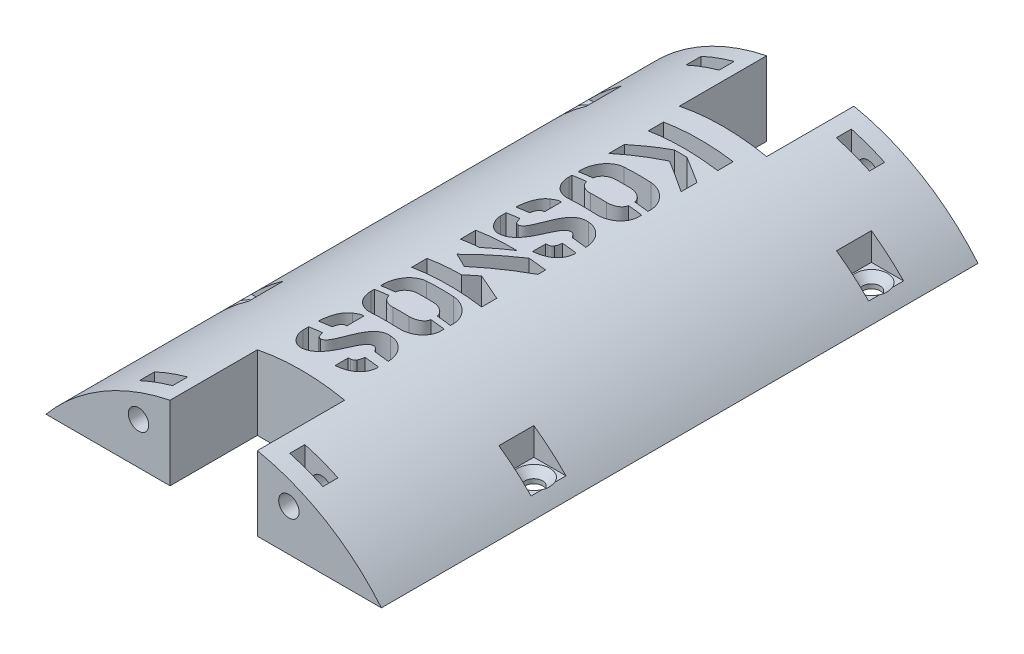
from build123d import *

# Parameters (mm, degrees)
BOSS_EXTRU_2_DEPTH       = 102.5
ESQUISSE7_R              = 1.75
ENL_V_MAT_EXTRU_4_DEPTH  = 12
ENL_V_START              = -5.6
ENL_V_MAT_EXTRU_5_DEPTH  = 2.6
ENL_V_START_2            = -12
ESQUISSE12_R             = 1.75
ENL_V_MAT_EXTRU_6_DEPTH  = 12
ENL_V_START_3            = -3
ENL_V_MAT_EXTRU_7_DEPTH  = 2.6
ESQUISSE21_W             = 15
ESQUISSE21_H             = 15
ENL_V_MAT_EXTRU_14_DEPTH = 108.325439668
ESQUISSE23_R             = 1.5
ENL_V_MAT_EXTRU_15_DEPTH = 108.325439668
ENL_V_START_4            = -2
ESQUISSE24_W             = 6
ESQUISSE24_H             = 6
ENL_V_MAT_EXTRU_16_DEPTH = 106.325439803
ENL_V_START_5            = 24
ENL_V_MAT_EXTRU_18_DEPTH = 13.5
CHANFREIN1_SIZE          = 1.25


# Read off the part's stored shape, not the designer's step: Enlèv. mat.-Extru.18
with BuildPart() as part:
    # Esquisse3 → Boss.-Extru.2 (new body)
    with BuildSketch(Plane.XY):
        with BuildLine():
            ThreePointArc((-28.814059068, 24), (0, 37.5), (28.814059068, 24))
            Line((28.814059068, 24), (18, 24))
            Line((18, 24), (-18, 24))
            Line((-18, 24), (-28.814059068, 24))
        make_face()
    extrude(amount=BOSS_EXTRU_2_DEPTH)

    # Esquisse7 → Enlèv. mat.-Extru.4 (cut)
    with BuildSketch(Plane.XY.offset(102.5)):
        with Locations((-12.915565842, 31.180934222)):
            Circle(ESQUISSE7_R)
        with Locations((12.915565842, 31.180934222)):
            Circle(ESQUISSE7_R)
    extrude(amount=-ENL_V_MAT_EXTRU_4_DEPTH, mode=Mode.SUBTRACT)

    # Esquisse11 → Enlèv. mat.-Extru.5 (cut)
    with BuildSketch(Plane.XY.offset(102.5).offset(ENL_V_START)):
        with BuildLine():
            Line((-15.765565842, 31.180934222), (-15.765565842, 34.024945756))
            ThreePointArc((-15.765565842, 34.024945756), (-12.95813326, 35.190009696), (-10.065565842, 36.123875543))
            Line((-10.065565842, 36.123875543), (-10.065565842, 29.426382489))
            Line((-10.065565842, 29.426382489), (-12.915565842, 27.780934222))
            Line((-12.915565842, 27.780934222), (-15.765565842, 29.426382489))
            Line((-15.765565842, 29.426382489), (-15.765565842, 31.180934222))
        make_face()
        with BuildLine():
            Line((10.065565842, 36.123875543), (10.065565842, 29.426382489))
            Line((10.065565842, 29.426382489), (12.915565842, 27.780934222))
            Line((12.915565842, 27.780934222), (15.765565842, 29.426382489))
            Line((15.765565842, 29.426382489), (15.765565842, 34.024945756))
            ThreePointArc((15.765565842, 34.024945756), (12.95813326, 35.190009696), (10.065565842, 36.123875543))
        make_face()
    extrude(amount=ENL_V_MAT_EXTRU_5_DEPTH, mode=Mode.SUBTRACT)

    # Esquisse12 → Enlèv. mat.-Extru.6 (cut)
    with BuildSketch(Plane(origin=(0, 0, 0), x_dir=(-1, 0, 0), z_dir=(0, 0, -1)).offset(ENL_V_START_2)):
        with Locations(Location((-12.915565842, 31.180934222, 0), (0, 0, 180))):
            Circle(ESQUISSE12_R)
        with Locations(Location((12.915565842, 31.180934222, 0), (0, 0, 180))):
            Circle(ESQUISSE12_R)
    extrude(amount=ENL_V_MAT_EXTRU_6_DEPTH, mode=Mode.SUBTRACT)

    # Esquisse14 → Enlèv. mat.-Extru.7 (cut)
    with BuildSketch(Plane(origin=(0, 0, 0), x_dir=(-1, 0, 0), z_dir=(0, 0, -1)).offset(ENL_V_START_3)):
        with BuildLine():
            Line((-15.765565842, 31.689067965), (-15.765565842, 34.024945756))
            ThreePointArc((-15.765565842, 34.024945756), (-12.95813326, 35.190009696), (-10.065565842, 36.123875543))
            Line((-10.065565842, 36.123875543), (-10.065565842, 29.426382489))
            Line((-10.065565842, 29.426382489), (-12.915565842, 27.780934222))
            Line((-12.915565842, 27.780934222), (-15.765565842, 29.426382489))
            Line((-15.765565842, 29.426382489), (-15.765565842, 31.689067965))
        make_face()
        with BuildLine():
            Line((10.065565842, 36.123875543), (10.065565842, 29.426382489))
            Line((10.065565842, 29.426382489), (12.915565842, 27.780934222))
            Line((12.915565842, 27.780934222), (15.765565842, 29.426382489))
            Line((15.765565842, 29.426382489), (15.765565842, 34.024945756))
            ThreePointArc((15.765565842, 34.024945756), (12.95813326, 35.190009696), (10.065565842, 36.123875543))
        make_face()
    extrude(amount=-ENL_V_MAT_EXTRU_7_DEPTH, mode=Mode.SUBTRACT)

    # Esquisse21 → Enlèv. mat.-Extru.14 (cut, through all)
    with BuildSketch(Plane.XZ.offset(-24)):
        with Locations((0, 95)):
            Rectangle(ESQUISSE21_W, ESQUISSE21_H)
        with Locations((0, 7.5)):
            Rectangle(ESQUISSE21_W, ESQUISSE21_H)
    extrude(amount=-ENL_V_MAT_EXTRU_14_DEPTH, mode=Mode.SUBTRACT)

    # Esquisse23 → Enlèv. mat.-Extru.15 (cut, through all)
    with BuildSketch(Plane(origin=(0, 24, 0), x_dir=(-1, 0, 0), z_dir=(0, -1, 0))):
        with Locations(Location((24.5, -72, 0), (0, 0, 180))):
            Circle(ESQUISSE23_R)
        with Locations(Location((-24.5, -72, 0), (0, 0, 180))):
            Circle(ESQUISSE23_R)
        with Locations(Location((-24.5, -14, 0), (0, 0, 180))):
            Circle(ESQUISSE23_R)
        with Locations(Location((24.5, -14, 0), (0, 0, 180))):
            Circle(ESQUISSE23_R)
    extrude(amount=-ENL_V_MAT_EXTRU_15_DEPTH, mode=Mode.SUBTRACT)

    # Esquisse24 → Enlèv. mat.-Extru.16 (cut, through all)
    with BuildSketch(Plane.XZ.offset(-24).offset(ENL_V_START_4)):
        with Locations((-24.5, 72)):
            Rectangle(ESQUISSE24_W, ESQUISSE24_H)
        with Locations((24.5, 72)):
            Rectangle(ESQUISSE24_W, ESQUISSE24_H)
        with Locations((-24.5, 14)):
            Rectangle(ESQUISSE24_W, ESQUISSE24_H)
        with Locations((24.5, 14)):
            Rectangle(ESQUISSE24_W, ESQUISSE24_H)
    extrude(amount=-ENL_V_MAT_EXTRU_16_DEPTH, mode=Mode.SUBTRACT)

    # Enlèv. mat.-Extru.18 outline → Enlèv. mat.-Extru.18 (cut)
    with BuildSketch(Plane(origin=(0, 0, 0), x_dir=(1, 0, 0), z_dir=(0, 1, 0)).offset(ENL_V_START_5)):
        with BuildLine():
            add(Edge.make_bspline(
                [(-2.950862943, -76.906779661), (-2.986527326, -76.905041027), (-3.057007817, -76.901605111), (-3.158722985, -76.926677288), (-3.257260341, -76.961631537), (-3.376607486, -77.044237647), (-3.514592223, -77.171401241), (-3.648672822, -77.359755644), (-3.763212671, -77.56655163), (-3.845812414, -77.789275215), (-3.91011019, -78.004908567), (-3.939602166, -78.146279026), (-3.95328425, -78.211864407)],
                knots=[0, 0, 0, 0, 0.059739722, 0.11805854, 0.174791134, 0.234669553, 0.360528163, 0.488701624, 0.621765205, 0.757163414, 0.887341881, 1, 1, 1, 1], degree=3))
            Line((-2.950862943, -76.906779661), (-2.715996114, -76.906779661))
            Line((-2.715996114, -76.906779661), (-2.715996114, -73.962469734))
            Line((-2.715996114, -73.962469734), (-2.916964637, -73.962469734))
            add(Edge.make_bspline(
                [(-4.289845993, -74.378934625), (-4.178455599, -74.330530752), (-3.957908385, -74.23469359), (-3.683433367, -74.115031042), (-3.460390763, -74.034079541), (-3.285626678, -73.993923938), (-3.104362541, -73.965138865), (-2.980038059, -73.963368096), (-2.916964637, -73.962469734)],
                knots=[0, 0, 0, 0, 0.251695278, 0.498343621, 0.620536837, 0.742649893, 0.869438815, 1, 1, 1, 1], degree=3))
            add(Edge.make_bspline(
                [(-6.297109916, -78.211864407), (-6.286845825, -78.029897284), (-6.265790595, -77.656619228), (-6.167470896, -77.09639047), (-6.028424477, -76.535094499), (-5.855245689, -76.084460648), (-5.687978965, -75.741340517), (-5.545164531, -75.495206592), (-5.381014198, -75.262946016), (-5.204295705, -75.039650757), (-5.006666029, -74.83626394), (-4.787440234, -74.656875843), (-4.549193218, -74.501204422), (-4.376447566, -74.419763119), (-4.289845993, -74.378934625)],
                knots=[0, 0, 0, 0, 0.12000572, 0.2461736, 0.3741357, 0.500563374, 0.563356879, 0.625566582, 0.687828552, 0.750622056, 0.813054157, 0.874273868, 0.93697045, 1, 1, 1, 1], degree=3))
            Line((-6.297109916, -78.211864407), (-3.95328425, -78.211864407))
        make_face()
        with BuildLine():
            add(Edge.make_bspline(
                [(2.090299285, -29.487893462), (2.21160641, -29.490657757), (2.453110044, -29.496161037), (2.810416505, -29.55577284), (3.160601314, -29.643763964), (3.498955424, -29.770883303), (3.822490475, -29.927219878), (4.126136482, -30.112965012), (4.411208017, -30.320978693), (4.673044315, -30.556414602), (4.910539677, -30.816564174), (5.125537607, -31.098821331), (5.312819789, -31.40487452), (5.479955806, -31.728297537), (5.608617783, -32.070776733), (5.70500945, -32.424685303), (5.761317085, -32.788750487), (5.769165207, -33.034922174), (5.773108002, -33.158595642)],
                knots=[0, 0, 0, 0, 0.063126667, 0.125675383, 0.188177464, 0.250960251, 0.313569684, 0.375068428, 0.436111449, 0.497137097, 0.558133778, 0.61934304, 0.681639789, 0.744809833, 0.808675451, 0.871797918, 0.935592934, 1, 1, 1, 1], degree=3))
            Line((2.090299285, -29.487893462), (-2.529555436, -29.487893462))
            add(Edge.make_bspline(
                [(-6.209942846, -33.158595642), (-6.206021507, -33.03491342), (-6.198216093, -32.788724307), (-6.141591596, -32.424788407), (-6.046318881, -32.070112809), (-5.913151394, -31.729548291), (-5.750370561, -31.404133983), (-5.562142165, -31.098924629), (-5.347411425, -30.816570758), (-5.109959009, -30.556286453), (-4.848170797, -30.321918999), (-4.564830536, -30.11140062), (-4.259602359, -29.928074077), (-3.935895627, -29.770686345), (-3.598096574, -29.644268173), (-3.248966606, -29.55539874), (-2.892349242, -29.496223172), (-2.650856893, -29.490678532), (-2.529555436, -29.487893462)],
                knots=[0, 0, 0, 0, 0.064434398, 0.128256487, 0.191405741, 0.255449157, 0.318456806, 0.380779992, 0.442015229, 0.503037796, 0.564089341, 0.624819907, 0.686704492, 0.749340495, 0.812149926, 0.874271284, 0.936846545, 1, 1, 1, 1], degree=3))
            Line((-6.209942846, -33.158595642), (-6.209942846, -33.676755448))
            Line((-6.209942846, -33.676755448), (-3.650620812, -33.676755448))
            add(Edge.make_bspline(
                [(-1.456916211, -32.122276029), (-1.575130211, -32.126930227), (-1.815491922, -32.136393497), (-2.172925571, -32.215013923), (-2.521333026, -32.336989854), (-2.851375189, -32.502984292), (-3.147304685, -32.719884175), (-3.351064027, -32.947003924), (-3.48509743, -33.149064668), (-3.562234844, -33.314931963), (-3.619228224, -33.491559183), (-3.640027746, -33.614263112), (-3.650620812, -33.676755448)],
                knots=[0, 0, 0, 0, 0.121201532, 0.24643619, 0.37373784, 0.499303427, 0.624198041, 0.747933951, 0.810187362, 0.872429755, 0.93502928, 1, 1, 1, 1], degree=3))
            Line((-1.456916211, -32.122276029), (1.320323498, -32.122276029))
            add(Edge.make_bspline(
                [(3.514028099, -33.676755448), (3.503434555, -33.614263733), (3.482634095, -33.491561024), (3.42564754, -33.31492493), (3.348484535, -33.149090906), (3.214578157, -32.946865018), (3.011160187, -32.722442522), (2.72174819, -32.501519587), (2.393048134, -32.33622719), (2.042824487, -32.214675072), (1.682054547, -32.136591699), (1.439330844, -32.126985799), (1.320323498, -32.122276029)],
                knots=[0, 0, 0, 0, 0.064937732, 0.127505474, 0.189716263, 0.251938067, 0.375611151, 0.498458692, 0.623224005, 0.751242206, 0.878034141, 1, 1, 1, 1], degree=3))
            Line((3.514028099, -33.676755448), (5.773108002, -33.676755448))
            Line((5.773108002, -33.676755448), (5.773108002, -33.158595642))
        make_face()
        with BuildLine():
            add(Edge.make_bspline(
                [(1.320323498, -36.3062954), (1.439392998, -36.301848839), (1.682409551, -36.292773569), (2.042353627, -36.210444148), (2.393950557, -36.090895413), (2.720140815, -35.921296434), (3.012324326, -35.704332414), (3.213240308, -35.479156307), (3.34918292, -35.279146269), (3.425536383, -35.113571219), (3.482663184, -34.937030105), (3.503444371, -34.814314343), (3.514028099, -34.751815981)],
                knots=[0, 0, 0, 0, 0.122044106, 0.249087617, 0.377187948, 0.502414671, 0.624840464, 0.748592891, 0.810162024, 0.872412725, 0.935020607, 1, 1, 1, 1], degree=3))
            Line((1.320323498, -36.3062954), (-1.456916211, -36.3062954))
            add(Edge.make_bspline(
                [(-3.633671659, -34.751815981), (-3.622800968, -34.814215765), (-3.601497659, -34.936500715), (-3.548581044, -35.11422711), (-3.470346046, -35.277587114), (-3.374565279, -35.42985801), (-3.262918336, -35.56913589), (-3.139690447, -35.699040802), (-2.999906168, -35.813372337), (-2.796314422, -35.947236406), (-2.522207982, -36.090263766), (-2.172458248, -36.210071754), (-1.815849975, -36.292982503), (-1.575192785, -36.301908507), (-1.456916211, -36.3062954)],
                knots=[0, 0, 0, 0, 0.065218183, 0.127808171, 0.190287635, 0.251181679, 0.312724901, 0.373873791, 0.435293353, 0.498241206, 0.624665583, 0.752452105, 0.87833683, 1, 1, 1, 1], degree=3))
            Line((-3.633671659, -34.751815981), (-6.209942846, -34.751815981))
            Line((-6.209942846, -34.751815981), (-6.209942846, -35.286924939))
            add(Edge.make_bspline(
                [(-2.529555436, -38.940677966), (-2.650829813, -38.937681782), (-2.892146061, -38.931719863), (-3.248847214, -38.875740719), (-3.598039577, -38.789285694), (-3.935259778, -38.664810712), (-4.259302649, -38.512575327), (-4.566108263, -38.334598036), (-4.848007969, -38.12334201), (-5.109995779, -37.889300486), (-5.347427402, -37.628944312), (-5.562040234, -37.346550966), (-5.75115262, -37.040961473), (-5.911898182, -36.714605185), (-6.046933856, -36.374852799), (-6.141478823, -36.020685694), (-6.198244728, -35.656808076), (-6.206031082, -35.410611108), (-6.209942846, -35.286924939)],
                knots=[0, 0, 0, 0, 0.063224337, 0.125806127, 0.18789308, 0.250627648, 0.312971041, 0.374494384, 0.435293112, 0.496413179, 0.557504236, 0.618808201, 0.681201336, 0.74465657, 0.808379432, 0.871599562, 0.935493283, 1, 1, 1, 1], degree=3))
            Line((-2.529555436, -38.940677966), (2.090299285, -38.940677966))
            add(Edge.make_bspline(
                [(5.773108002, -35.286924939), (5.769174706, -35.410602295), (5.761345491, -35.656781721), (5.704897579, -36.020789488), (5.609231906, -36.374185413), (5.478704095, -36.715854862), (5.313600537, -37.040224937), (5.125435296, -37.346653493), (4.910555622, -37.628951055), (4.67308159, -37.889172463), (4.411042827, -38.124281045), (4.127431985, -38.333042689), (3.822172796, -38.5134181), (3.498322588, -38.664616124), (3.160538555, -38.789781109), (2.81030224, -38.875377545), (2.452906137, -38.931780998), (2.21157909, -38.937702229), (2.090299285, -38.940677966)],
                knots=[0, 0, 0, 0, 0.064479575, 0.128346412, 0.191539943, 0.25508426, 0.318701008, 0.381067891, 0.442346062, 0.503411414, 0.564505765, 0.625617508, 0.686752433, 0.749069595, 0.811777767, 0.874246806, 0.936802265, 1, 1, 1, 1], degree=3))
            Line((5.773108002, -35.286924939), (5.773108002, -34.751815981))
            Line((5.773108002, -34.751815981), (3.514028099, -34.751815981))
        make_face()
        with BuildLine():
            add(Edge.make_bspline(
                [(-3.096141393, -47.153753027), (-3.009736987, -47.148633923), (-2.839244616, -47.138532954), (-2.596594763, -47.042656516), (-2.379083896, -46.887694778), (-2.189341783, -46.673492896), (-2.017646516, -46.4176475), (-1.844384621, -46.133762397), (-1.677685569, -45.818126211), (-1.46130124, -45.348811065), (-1.19252681, -44.717391388), (-0.933246963, -44.06085675), (-0.710034852, -43.524465905), (-0.524259712, -43.129301198), (-0.319049088, -42.74928027), (-0.10485069, -42.381349018), (0.132152982, -42.036839081), (0.391095336, -41.719849131), (0.676740441, -41.435495001), (0.932191587, -41.222451272), (1.149664456, -41.070324431), (1.324078106, -40.974780046), (1.506782881, -40.891670991), (1.698421998, -40.82296725), (1.900906131, -40.773855386), (2.11153994, -40.733582334), (2.332802397, -40.712442297), (2.483319993, -40.70965369), (2.560032941, -40.708232446)],
                knots=[0, 0, 0, 0, 0.028252653, 0.055747872, 0.084257553, 0.115185245, 0.149054068, 0.18529981, 0.22427851, 0.266101869, 0.354849093, 0.449423178, 0.497727041, 0.545470779, 0.59262841, 0.639411967, 0.685106362, 0.729698365, 0.773520039, 0.817162075, 0.838686151, 0.860499936, 0.882308897, 0.904506765, 0.927181389, 0.950609122, 0.974827396, 1, 1, 1, 1], degree=3))
            add(Edge.make_bspline(
                [(-3.563453742, -46.884987893), (-3.552978153, -46.892275776), (-3.525780953, -46.911196909), (-3.476843096, -46.943963314), (-3.409136965, -46.98562487), (-3.33179991, -47.035567747), (-3.252432099, -47.08152727), (-3.187735549, -47.122519197), (-3.137161022, -47.146407211), (-3.107549278, -47.151710097), (-3.096141393, -47.153753027)],
                knots=[0, 0, 0, 0, 0.070692933, 0.183536217, 0.326188881, 0.511020824, 0.693512683, 0.833834149, 0.935984826, 1, 1, 1, 1], degree=3))
            add(Edge.make_bspline(
                [(-3.916964637, -45.964891041), (-3.897792206, -46.046477691), (-3.859953481, -46.207497155), (-3.757645449, -46.432868242), (-3.652235338, -46.654569938), (-3.593162254, -46.807884361), (-3.563453742, -46.884987893)],
                knots=[0, 0, 0, 0, 0.253950028, 0.50119594, 0.749145877, 1, 1, 1, 1], degree=3))
            Line((-3.916964637, -45.964891041), (-6.309216453, -45.964891041))
            Line((-6.309216453, -45.964891041), (-6.292267301, -46.935835351))
            add(Edge.make_bspline(
                [(-3.331008221, -50.098062954), (-3.424926301, -50.095184037), (-3.613624321, -50.089399784), (-3.891533409, -50.030346451), (-4.165495143, -49.940696292), (-4.428763544, -49.810457627), (-4.684304177, -49.656011062), (-4.928289592, -49.479673225), (-5.152752715, -49.275977352), (-5.365856684, -49.056940391), (-5.561147901, -48.820611323), (-5.736804756, -48.569553155), (-5.890730497, -48.305654761), (-6.026444475, -48.033611515), (-6.137698239, -47.757003799), (-6.221043945, -47.48095101), (-6.273109575, -47.207204261), (-6.285928828, -47.025619724), (-6.292267301, -46.935835351)],
                knots=[0, 0, 0, 0, 0.059748021, 0.120044332, 0.180200194, 0.242977184, 0.306638504, 0.370293595, 0.434381163, 0.499465314, 0.564833147, 0.629444458, 0.694431062, 0.759271072, 0.822951073, 0.884113561, 0.942700014, 1, 1, 1, 1], degree=3))
            add(Edge.make_bspline(
                [(2.644778704, -43.638014528), (2.563156917, -43.643227546), (2.400421846, -43.653621105), (2.167763564, -43.751250442), (1.953743528, -43.904439917), (1.765136494, -44.120370686), (1.584092699, -44.37315337), (1.408885649, -44.660763825), (1.232415777, -44.976052692), (1.007056883, -45.45138929), (0.718659119, -46.089194206), (0.427937334, -46.750069052), (0.183400061, -47.292270758), (-0.030682248, -47.686562698), (-0.253899018, -48.069631708), (-0.496134257, -48.436386446), (-0.756564327, -48.781403042), (-1.042341317, -49.09691201), (-1.349708364, -49.379394995), (-1.677421933, -49.633729771), (-2.037119385, -49.843444429), (-2.436452536, -49.99148811), (-2.871615262, -50.083464914), (-3.174761596, -50.093097936), (-3.331008221, -50.098062954)],
                knots=[0, 0, 0, 0, 0.0260873, 0.052012076, 0.079683049, 0.109930162, 0.143503311, 0.17944295, 0.217934321, 0.259405811, 0.348194619, 0.442581601, 0.491136334, 0.538993122, 0.586480495, 0.633390778, 0.679963043, 0.725071785, 0.769798167, 0.813780368, 0.857986986, 0.902823481, 0.949913618, 1, 1, 1, 1], degree=3))
            add(Edge.make_bspline(
                [(3.448652796, -44.357142857), (3.424198252, -44.322609953), (3.373223616, -44.250627328), (3.298874744, -44.135232363), (3.207094172, -44.02239159), (3.117677476, -43.902111718), (3.012331841, -43.798223591), (2.900990042, -43.709663554), (2.776749857, -43.650200187), (2.688136514, -43.642018005), (2.644778704, -43.638014528)],
                knots=[0, 0, 0, 0, 0.113463457, 0.236510589, 0.367663854, 0.503189797, 0.637849087, 0.762934561, 0.884005751, 1, 1, 1, 1], degree=3))
            Line((3.448652796, -44.357142857), (5.773108002, -44.357142857))
            add(Edge.make_bspline(
                [(2.560032941, -40.708232446), (2.684519213, -40.712052623), (2.928319527, -40.719534256), (3.283080249, -40.775072351), (3.615919517, -40.870824427), (3.926989189, -41.000908382), (4.212218326, -41.167485797), (4.475839721, -41.357262662), (4.716662503, -41.571595411), (4.935651423, -41.809482093), (5.12913612, -42.071158806), (5.296925072, -42.35509667), (5.441682457, -42.657365734), (5.563117095, -42.977113814), (5.656290745, -43.310414263), (5.725105472, -43.652621346), (5.763557503, -44.002753789), (5.769908291, -44.238411603), (5.773108002, -44.357142857)],
                knots=[0, 0, 0, 0, 0.068668367, 0.13448366, 0.197485073, 0.259347855, 0.319993461, 0.379316789, 0.438299873, 0.49754962, 0.557398738, 0.61750078, 0.679243245, 0.742098134, 0.80595611, 0.869969157, 0.934486683, 1, 1, 1, 1], degree=3))
        make_face()
        with BuildLine():
            add(Edge.make_bspline(
                [(3.167781125, -47.153753027), (3.214049132, -47.068040684), (3.307175986, -46.895521453), (3.383370172, -46.6096316), (3.429920591, -46.320664019), (3.457034261, -46.127985571), (3.470444564, -46.032687651)],
                knots=[0, 0, 0, 0, 0.248980391, 0.501140256, 0.753266147, 1, 1, 1, 1], degree=3))
            add(Edge.make_bspline(
                [(2.545505096, -47.589588378), (2.580392586, -47.588520345), (2.648651237, -47.5864307), (2.746446076, -47.560372615), (2.837927303, -47.522832565), (2.94404028, -47.445376348), (3.061487811, -47.32579296), (3.131925538, -47.211786714), (3.167781125, -47.153753027)],
                knots=[0, 0, 0, 0, 0.130419604, 0.255170732, 0.377138957, 0.498844198, 0.744891882, 1, 1, 1, 1], degree=3))
            add(Edge.make_bspline(
                [(2.208943353, -47.739709443), (2.211066808, -47.726347154), (2.215482653, -47.698559524), (2.24576708, -47.663081263), (2.29241101, -47.63600389), (2.369733697, -47.616326768), (2.455021459, -47.596600781), (2.520410655, -47.591533175), (2.545505096, -47.589588378)],
                knots=[0, 0, 0, 0, 0.100717267, 0.209447198, 0.338272, 0.504397133, 0.809802262, 1, 1, 1, 1], degree=3))
            Line((2.208943353, -47.739709443), (2.208943353, -49.914043584))
            add(Edge.make_bspline(
                [(5.790057154, -46.100484262), (5.787022585, -46.229009347), (5.781062323, -46.481448226), (5.727463793, -46.851591923), (5.647225831, -47.207764745), (5.527145748, -47.545898191), (5.379269965, -47.866722918), (5.204467952, -48.167121449), (5.005588063, -48.448612342), (4.776627129, -48.705119383), (4.524052833, -48.939279383), (4.252146115, -49.155075508), (3.954724418, -49.343145064), (3.637536838, -49.510333004), (3.30252128, -49.653100641), (2.950336116, -49.766315542), (2.58568113, -49.857482964), (2.335237268, -49.89508275), (2.208943353, -49.914043584)],
                knots=[0, 0, 0, 0, 0.066979442, 0.131555759, 0.194643474, 0.257066546, 0.318263214, 0.378607407, 0.438048186, 0.497671931, 0.557522488, 0.617466188, 0.678406186, 0.740717084, 0.80426633, 0.868014535, 0.933442326, 1, 1, 1, 1], degree=3))
            Line((5.790057154, -46.100484262), (5.773108002, -46.032687651))
            Line((5.773108002, -46.032687651), (3.470444564, -46.032687651))
        make_face()
        with BuildLine():
            add(Edge.make_bspline(
                [(1.501921561, -57.976997579), (1.52370549, -57.985089684), (1.576128863, -58.004563464), (1.670950076, -58.039034831), (1.79437398, -58.086858141), (2.00871556, -58.172480785), (2.324729751, -58.29729909), (2.7459853, -58.46731501), (3.211435571, -58.652505414), (3.700675234, -58.835216469), (4.182608229, -59.018181897), (4.567329054, -59.165772155), (4.852130847, -59.27501593), (5.043561299, -59.348595728), (5.219547716, -59.411721923), (5.376920649, -59.462325272), (5.506461388, -59.508245853), (5.607305404, -59.532561177), (5.673963655, -59.552476772), (5.708499061, -59.551250215), (5.719839237, -59.550847458)],
                knots=[0, 0, 0, 0, 0.015471738, 0.037232984, 0.067170978, 0.103592436, 0.190904052, 0.293382723, 0.406040464, 0.524405172, 0.641072006, 0.749250124, 0.798748136, 0.844157075, 0.885797806, 0.923181698, 0.954278764, 0.977089496, 0.992477021, 1, 1, 1, 1], degree=3))
            Line((1.501921561, -57.976997579), (-0.355221296, -59.550847458))
            Line((-0.355221296, -59.550847458), (-6.297109916, -59.550847458))
            Line((-6.297109916, -59.550847458), (-6.297109916, -62.185230024))
            Line((-6.297109916, -62.185230024), (5.719839237, -62.185230024))
            Line((5.719839237, -62.185230024), (5.719839237, -59.550847458))
        make_face()
        with BuildLine():
            add(Edge.make_bspline(
                [(-2.950862943, -42.969733656), (-2.986527326, -42.967995022), (-3.057007817, -42.964559106), (-3.158722985, -42.989631283), (-3.257260341, -43.024585532), (-3.376607486, -43.107191642), (-3.514592223, -43.234355236), (-3.648672822, -43.422709639), (-3.763212671, -43.629505625), (-3.845812414, -43.85222921), (-3.91011019, -44.067862562), (-3.939602166, -44.209233021), (-3.95328425, -44.274818402)],
                knots=[0, 0, 0, 0, 0.059739722, 0.11805854, 0.174791134, 0.234669553, 0.360528163, 0.488701624, 0.621765205, 0.757163414, 0.887341881, 1, 1, 1, 1], degree=3))
            Line((-2.950862943, -42.969733656), (-2.715996114, -42.969733656))
            Line((-2.715996114, -42.969733656), (-2.715996114, -40.025423729))
            Line((-2.715996114, -40.025423729), (-2.916964637, -40.025423729))
            add(Edge.make_bspline(
                [(-4.289845993, -40.44188862), (-4.178455599, -40.393484747), (-3.957908385, -40.297647585), (-3.683433367, -40.177985037), (-3.460390763, -40.097033536), (-3.285626678, -40.056877933), (-3.104362541, -40.02809286), (-2.980038059, -40.026322091), (-2.916964637, -40.025423729)],
                knots=[0, 0, 0, 0, 0.251695278, 0.498343621, 0.620536837, 0.742649893, 0.869438815, 1, 1, 1, 1], degree=3))
            add(Edge.make_bspline(
                [(-6.297109916, -44.274818402), (-6.286845825, -44.092851279), (-6.265790595, -43.719573224), (-6.167470896, -43.159344465), (-6.028424477, -42.598048494), (-5.855245689, -42.147414643), (-5.687978965, -41.804294512), (-5.545164531, -41.558160587), (-5.381014198, -41.325900011), (-5.204295705, -41.102604753), (-5.006666029, -40.899217935), (-4.787440234, -40.719829839), (-4.549193218, -40.564158417), (-4.376447566, -40.482717114), (-4.289845993, -40.44188862)],
                knots=[0, 0, 0, 0, 0.12000572, 0.2461736, 0.3741357, 0.500563374, 0.563356879, 0.625566582, 0.687828552, 0.750622056, 0.813054157, 0.874273868, 0.93697045, 1, 1, 1, 1], degree=3))
            Line((-6.297109916, -44.274818402), (-3.95328425, -44.274818402))
        make_face()
        with BuildLine():
            add(Edge.make_bspline(
                [(2.090299285, -63.424939467), (2.21160641, -63.427703761), (2.453110044, -63.433207041), (2.810416505, -63.492818845), (3.160601314, -63.580809969), (3.498955424, -63.707929307), (3.822490475, -63.864265883), (4.126136482, -64.050011017), (4.411208017, -64.258024698), (4.673044315, -64.493460607), (4.910539677, -64.753610179), (5.125537607, -65.035867336), (5.312819789, -65.341920525), (5.479955806, -65.665343541), (5.608617783, -66.007822738), (5.70500945, -66.361731307), (5.761317085, -66.725796491), (5.769165207, -66.971968179), (5.773108002, -67.095641646)],
                knots=[0, 0, 0, 0, 0.063126667, 0.125675383, 0.188177464, 0.250960251, 0.313569684, 0.375068428, 0.436111449, 0.497137097, 0.558133778, 0.61934304, 0.681639789, 0.744809833, 0.808675451, 0.871797918, 0.935592934, 1, 1, 1, 1], degree=3))
            Line((2.090299285, -63.424939467), (-2.529555436, -63.424939467))
            add(Edge.make_bspline(
                [(-6.209942846, -67.095641646), (-6.206021507, -66.971959425), (-6.198216093, -66.725770312), (-6.141591596, -66.361834412), (-6.046318881, -66.007158814), (-5.913151394, -65.666594296), (-5.750370561, -65.341179988), (-5.562142165, -65.035970634), (-5.347411425, -64.753616763), (-5.109959009, -64.493332458), (-4.848170797, -64.258965004), (-4.564830536, -64.048446625), (-4.259602359, -63.865120082), (-3.935895627, -63.70773235), (-3.598096574, -63.581314178), (-3.248966606, -63.492444745), (-2.892349242, -63.433269177), (-2.650856893, -63.427724537), (-2.529555436, -63.424939467)],
                knots=[0, 0, 0, 0, 0.064434398, 0.128256487, 0.191405741, 0.255449157, 0.318456806, 0.380779992, 0.442015229, 0.503037796, 0.564089341, 0.624819907, 0.686704492, 0.749340495, 0.812149926, 0.874271284, 0.936846545, 1, 1, 1, 1], degree=3))
            Line((-6.209942846, -67.095641646), (-6.209942846, -67.613801453))
            Line((-6.209942846, -67.613801453), (-3.650620812, -67.613801453))
            add(Edge.make_bspline(
                [(-1.456916211, -66.059322034), (-1.575130211, -66.063976232), (-1.815491922, -66.073439502), (-2.172925571, -66.152059928), (-2.521333026, -66.274035858), (-2.851375189, -66.440030297), (-3.147304685, -66.65693018), (-3.351064027, -66.884049928), (-3.48509743, -67.086110672), (-3.562234844, -67.251977968), (-3.619228224, -67.428605188), (-3.640027746, -67.551309117), (-3.650620812, -67.613801453)],
                knots=[0, 0, 0, 0, 0.121201532, 0.24643619, 0.37373784, 0.499303427, 0.624198041, 0.747933951, 0.810187362, 0.872429755, 0.93502928, 1, 1, 1, 1], degree=3))
            Line((-1.456916211, -66.059322034), (1.320323498, -66.059322034))
            add(Edge.make_bspline(
                [(3.514028099, -67.613801453), (3.503434555, -67.551309738), (3.482634095, -67.428607028), (3.42564754, -67.251970935), (3.348484535, -67.086136911), (3.214578157, -66.883911022), (3.011160187, -66.659488527), (2.72174819, -66.438565591), (2.393048134, -66.273273195), (2.042824487, -66.151721077), (1.682054547, -66.073637704), (1.439330844, -66.064031804), (1.320323498, -66.059322034)],
                knots=[0, 0, 0, 0, 0.064937732, 0.127505474, 0.189716263, 0.251938067, 0.375611151, 0.498458692, 0.623224005, 0.751242206, 0.878034141, 1, 1, 1, 1], degree=3))
            Line((3.514028099, -67.613801453), (5.773108002, -67.613801453))
            Line((5.773108002, -67.613801453), (5.773108002, -67.095641646))
        make_face()
        with BuildLine():
            add(Edge.make_bspline(
                [(1.320323498, -70.243341404), (1.439392998, -70.238894844), (1.682409551, -70.229819574), (2.042353627, -70.147490152), (2.393950557, -70.027941418), (2.720140815, -69.858342439), (3.012324326, -69.641378419), (3.213240308, -69.416202312), (3.34918292, -69.216192274), (3.425536383, -69.050617224), (3.482663184, -68.87407611), (3.503444371, -68.751360348), (3.514028099, -68.688861985)],
                knots=[0, 0, 0, 0, 0.122044106, 0.249087617, 0.377187948, 0.502414671, 0.624840464, 0.748592891, 0.810162024, 0.872412725, 0.935020607, 1, 1, 1, 1], degree=3))
            Line((1.320323498, -70.243341404), (-1.456916211, -70.243341404))
            add(Edge.make_bspline(
                [(-3.633671659, -68.688861985), (-3.622800968, -68.751261769), (-3.601497659, -68.87354672), (-3.548581044, -69.051273114), (-3.470346046, -69.214633119), (-3.374565279, -69.366904015), (-3.262918336, -69.506181895), (-3.139690447, -69.636086806), (-2.999906168, -69.750418342), (-2.796314422, -69.88428241), (-2.522207982, -70.02730977), (-2.172458248, -70.147117759), (-1.815849975, -70.230028508), (-1.575192785, -70.238954512), (-1.456916211, -70.243341404)],
                knots=[0, 0, 0, 0, 0.065218183, 0.127808171, 0.190287635, 0.251181679, 0.312724901, 0.373873791, 0.435293353, 0.498241206, 0.624665583, 0.752452105, 0.87833683, 1, 1, 1, 1], degree=3))
            Line((-3.633671659, -68.688861985), (-6.209942846, -68.688861985))
            Line((-6.209942846, -68.688861985), (-6.209942846, -69.223970944))
            add(Edge.make_bspline(
                [(-2.529555436, -72.877723971), (-2.650829813, -72.874727787), (-2.892146061, -72.868765868), (-3.248847214, -72.812786724), (-3.598039577, -72.726331699), (-3.935259778, -72.601856717), (-4.259302649, -72.449621332), (-4.566108263, -72.271644041), (-4.848007969, -72.060388014), (-5.109995779, -71.826346491), (-5.347427402, -71.565990316), (-5.562040234, -71.283596971), (-5.75115262, -70.978007478), (-5.911898182, -70.65165119), (-6.046933856, -70.311898804), (-6.141478823, -69.957731699), (-6.198244728, -69.593854081), (-6.206031082, -69.347657113), (-6.209942846, -69.223970944)],
                knots=[0, 0, 0, 0, 0.063224337, 0.125806127, 0.18789308, 0.250627648, 0.312971041, 0.374494384, 0.435293112, 0.496413179, 0.557504236, 0.618808201, 0.681201336, 0.74465657, 0.808379432, 0.871599562, 0.935493283, 1, 1, 1, 1], degree=3))
            Line((-2.529555436, -72.877723971), (2.090299285, -72.877723971))
            add(Edge.make_bspline(
                [(5.773108002, -69.223970944), (5.769174706, -69.3476483), (5.761345491, -69.593827726), (5.704897579, -69.957835493), (5.609231906, -70.311231418), (5.478704095, -70.652900866), (5.313600537, -70.977270942), (5.125435296, -71.283699498), (4.910555622, -71.56599706), (4.67308159, -71.826218468), (4.411042827, -72.06132705), (4.127431985, -72.270088694), (3.822172796, -72.450464105), (3.498322588, -72.601662129), (3.160538555, -72.726827113), (2.81030224, -72.81242355), (2.452906137, -72.868827003), (2.21157909, -72.874748234), (2.090299285, -72.877723971)],
                knots=[0, 0, 0, 0, 0.064479575, 0.128346412, 0.191539943, 0.25508426, 0.318701008, 0.381067891, 0.442346062, 0.503411414, 0.564505765, 0.625617508, 0.686752433, 0.749069595, 0.811777767, 0.874246806, 0.936802265, 1, 1, 1, 1], degree=3))
            Line((5.773108002, -69.223970944), (5.773108002, -68.688861985))
            Line((5.773108002, -68.688861985), (3.514028099, -68.688861985))
        make_face()
        with BuildLine():
            add(Edge.make_bspline(
                [(-3.096141393, -81.090799031), (-3.009736987, -81.085679927), (-2.839244616, -81.075578959), (-2.596594763, -80.979702521), (-2.379083896, -80.824740783), (-2.189341783, -80.610538901), (-2.017646516, -80.354693505), (-1.844384621, -80.070808402), (-1.677685569, -79.755172215), (-1.46130124, -79.28585707), (-1.19252681, -78.654437393), (-0.933246963, -77.997902755), (-0.710034852, -77.46151191), (-0.524259712, -77.066347203), (-0.319049088, -76.686326275), (-0.10485069, -76.318395023), (0.132152982, -75.973885085), (0.391095336, -75.656895135), (0.676740441, -75.372541006), (0.932191587, -75.159497276), (1.149664456, -75.007370436), (1.324078106, -74.911826051), (1.506782881, -74.828716996), (1.698421998, -74.760013255), (1.900906131, -74.710901391), (2.11153994, -74.670628339), (2.332802397, -74.649488302), (2.483319993, -74.646699695), (2.560032941, -74.64527845)],
                knots=[0, 0, 0, 0, 0.028252653, 0.055747872, 0.084257553, 0.115185245, 0.149054068, 0.18529981, 0.22427851, 0.266101869, 0.354849093, 0.449423178, 0.497727041, 0.545470779, 0.59262841, 0.639411967, 0.685106362, 0.729698365, 0.773520039, 0.817162075, 0.838686151, 0.860499936, 0.882308897, 0.904506765, 0.927181389, 0.950609122, 0.974827396, 1, 1, 1, 1], degree=3))
            add(Edge.make_bspline(
                [(-3.563453742, -80.822033898), (-3.552978153, -80.829321781), (-3.525780953, -80.848242914), (-3.476843096, -80.881009319), (-3.409136965, -80.922670875), (-3.33179991, -80.972613752), (-3.252432099, -81.018573275), (-3.187735549, -81.059565202), (-3.137161022, -81.083453216), (-3.107549278, -81.088756102), (-3.096141393, -81.090799031)],
                knots=[0, 0, 0, 0, 0.070692933, 0.183536217, 0.326188881, 0.511020824, 0.693512683, 0.833834149, 0.935984826, 1, 1, 1, 1], degree=3))
            add(Edge.make_bspline(
                [(-3.916964637, -79.901937046), (-3.897792206, -79.983523696), (-3.859953481, -80.14454316), (-3.757645449, -80.369914247), (-3.652235338, -80.591615943), (-3.593162254, -80.744930366), (-3.563453742, -80.822033898)],
                knots=[0, 0, 0, 0, 0.253950028, 0.50119594, 0.749145877, 1, 1, 1, 1], degree=3))
            Line((-3.916964637, -79.901937046), (-6.309216453, -79.901937046))
            Line((-6.309216453, -79.901937046), (-6.292267301, -80.872881356))
            add(Edge.make_bspline(
                [(-3.331008221, -84.035108959), (-3.424926301, -84.032230042), (-3.613624321, -84.026445789), (-3.891533409, -83.967392455), (-4.165495143, -83.877742296), (-4.428763544, -83.747503632), (-4.684304177, -83.593057067), (-4.928289592, -83.41671923), (-5.152752715, -83.213023357), (-5.365856684, -82.993986396), (-5.561147901, -82.757657328), (-5.736804756, -82.50659916), (-5.890730497, -82.242700766), (-6.026444475, -81.97065752), (-6.137698239, -81.694049804), (-6.221043945, -81.417997015), (-6.273109575, -81.144250266), (-6.285928828, -80.962665729), (-6.292267301, -80.872881356)],
                knots=[0, 0, 0, 0, 0.059748021, 0.120044332, 0.180200194, 0.242977184, 0.306638504, 0.370293595, 0.434381163, 0.499465314, 0.564833147, 0.629444458, 0.694431062, 0.759271072, 0.822951073, 0.884113561, 0.942700014, 1, 1, 1, 1], degree=3))
            add(Edge.make_bspline(
                [(2.644778704, -77.575060533), (2.563156917, -77.580273551), (2.400421846, -77.590667109), (2.167763564, -77.688296447), (1.953743528, -77.841485922), (1.765136494, -78.05741669), (1.584092699, -78.310199374), (1.408885649, -78.59780983), (1.232415777, -78.913098697), (1.007056883, -79.388435295), (0.718659119, -80.026240211), (0.427937334, -80.687115057), (0.183400061, -81.229316762), (-0.030682248, -81.623608703), (-0.253899018, -82.006677713), (-0.496134257, -82.373432451), (-0.756564327, -82.718449047), (-1.042341317, -83.033958015), (-1.349708364, -83.316441), (-1.677421933, -83.570775776), (-2.037119385, -83.780490434), (-2.436452536, -83.928534115), (-2.871615262, -84.020510919), (-3.174761596, -84.030143941), (-3.331008221, -84.035108959)],
                knots=[0, 0, 0, 0, 0.0260873, 0.052012076, 0.079683049, 0.109930162, 0.143503311, 0.17944295, 0.217934321, 0.259405811, 0.348194619, 0.442581601, 0.491136334, 0.538993122, 0.586480495, 0.633390778, 0.679963043, 0.725071785, 0.769798167, 0.813780368, 0.857986986, 0.902823481, 0.949913618, 1, 1, 1, 1], degree=3))
            add(Edge.make_bspline(
                [(3.448652796, -78.294188862), (3.424198252, -78.259655958), (3.373223616, -78.187673333), (3.298874744, -78.072278368), (3.207094172, -77.959437594), (3.117677476, -77.839157723), (3.012331841, -77.735269596), (2.900990042, -77.646709559), (2.776749857, -77.587246192), (2.688136514, -77.57906401), (2.644778704, -77.575060533)],
                knots=[0, 0, 0, 0, 0.113463457, 0.236510589, 0.367663854, 0.503189797, 0.637849087, 0.762934561, 0.884005751, 1, 1, 1, 1], degree=3))
            Line((3.448652796, -78.294188862), (5.773108002, -78.294188862))
            add(Edge.make_bspline(
                [(2.560032941, -74.64527845), (2.684519213, -74.649098628), (2.928319527, -74.65658026), (3.283080249, -74.712118356), (3.615919517, -74.807870432), (3.926989189, -74.937954386), (4.212218326, -75.104531802), (4.475839721, -75.294308667), (4.716662503, -75.508641416), (4.935651423, -75.746528098), (5.12913612, -76.00820481), (5.296925072, -76.292142675), (5.441682457, -76.594411739), (5.563117095, -76.914159819), (5.656290745, -77.247460268), (5.725105472, -77.58966735), (5.763557503, -77.939799794), (5.769908291, -78.175457608), (5.773108002, -78.294188862)],
                knots=[0, 0, 0, 0, 0.068668367, 0.13448366, 0.197485073, 0.259347855, 0.319993461, 0.379316789, 0.438299873, 0.49754962, 0.557398738, 0.61750078, 0.679243245, 0.742098134, 0.80595611, 0.869969157, 0.934486683, 1, 1, 1, 1], degree=3))
        make_face()
        with BuildLine():
            add(Edge.make_bspline(
                [(3.167781125, -81.090799031), (3.214049132, -81.005086689), (3.307175986, -80.832567458), (3.383370172, -80.546677605), (3.429920591, -80.257710024), (3.457034261, -80.065031576), (3.470444564, -79.969733656)],
                knots=[0, 0, 0, 0, 0.248980391, 0.501140256, 0.753266147, 1, 1, 1, 1], degree=3))
            add(Edge.make_bspline(
                [(2.545505096, -81.526634383), (2.580392586, -81.52556635), (2.648651237, -81.523476705), (2.746446076, -81.49741862), (2.837927303, -81.45987857), (2.94404028, -81.382422352), (3.061487811, -81.262838965), (3.131925538, -81.148832718), (3.167781125, -81.090799031)],
                knots=[0, 0, 0, 0, 0.130419604, 0.255170732, 0.377138957, 0.498844198, 0.744891882, 1, 1, 1, 1], degree=3))
            add(Edge.make_bspline(
                [(2.208943353, -81.676755448), (2.211066808, -81.663393158), (2.215482653, -81.635605529), (2.24576708, -81.600127268), (2.29241101, -81.573049895), (2.369733697, -81.553372773), (2.455021459, -81.533646786), (2.520410655, -81.52857918), (2.545505096, -81.526634383)],
                knots=[0, 0, 0, 0, 0.100717267, 0.209447198, 0.338272, 0.504397133, 0.809802262, 1, 1, 1, 1], degree=3))
            Line((2.208943353, -81.676755448), (2.208943353, -83.851089588))
            add(Edge.make_bspline(
                [(5.790057154, -80.037530266), (5.787022585, -80.166055352), (5.781062323, -80.418494231), (5.727463793, -80.788637928), (5.647225831, -81.14481075), (5.527145748, -81.482944195), (5.379269965, -81.803768923), (5.204467952, -82.104167454), (5.005588063, -82.385658347), (4.776627129, -82.642165388), (4.524052833, -82.876325388), (4.252146115, -83.092121512), (3.954724418, -83.280191068), (3.637536838, -83.447379009), (3.30252128, -83.590146646), (2.950336116, -83.703361546), (2.58568113, -83.794528969), (2.335237268, -83.832128755), (2.208943353, -83.851089588)],
                knots=[0, 0, 0, 0, 0.066979442, 0.131555759, 0.194643474, 0.257066546, 0.318263214, 0.378607407, 0.438048186, 0.497671931, 0.557522488, 0.617466188, 0.678406186, 0.740717084, 0.80426633, 0.868014535, 0.933442326, 1, 1, 1, 1], degree=3))
            Line((5.790057154, -80.037530266), (5.773108002, -79.969733656))
            Line((5.773108002, -79.969733656), (3.470444564, -79.969733656))
        make_face()
        Polygon((-6.263211611, -18.950363196), (-6.263211611, -21.584745763), (5.702890084, -21.618644068), (5.702890084, -18.950363196), align=None)
        Polygon((0.581824709, -24.761501211), (5.702890084, -27.906779661), (5.702890084, -25.163438257), (1.484972409, -22.686440678), (-0.657884734, -22.686440678), (-6.297109916, -25.647699758), (-6.297109916, -28.308716707), align=None)
        Polygon((-1.410911369, -58.059322034), (5.702890084, -52.504842615), (5.702890084, -51.182808717), (2.857853764, -51.182808717), (-4.038030013, -56.671912833), align=None)
        Polygon((0.782793232, -51.182808717), (-6.297109916, -51.182808717), (-6.297109916, -53.817191283), (-2.984761248, -53.817191283), align=None)
    extrude(amount=ENL_V_MAT_EXTRU_18_DEPTH, mode=Mode.SUBTRACT)

    # Chanfrein1
    # the kernel refuses this chamfer: 1.25 mm, written as the material it takes off along each edge
    with BuildSketch(Plane(origin=(24.5, 26, 72), x_dir=(1, 0, 0), z_dir=(0, 0, -1))) as chanfrein1_piece_1:
        Polygon((1.5 + CHANFREIN1_SIZE, 0), (1.5, CHANFREIN1_SIZE), (1.5, 0), align=None)
    revolve(axis=Axis((24.5, 26, 72), (0, -1, 0)), mode=Mode.SUBTRACT)
    with BuildSketch(Plane(origin=(-24.5, 26, 14), x_dir=(1, 0, 0), z_dir=(0, 0, -1))) as chanfrein1_piece_2:
        Polygon((1.5 + CHANFREIN1_SIZE, 0), (1.5, CHANFREIN1_SIZE), (1.5, 0), align=None)
    revolve(axis=Axis((-24.5, 26, 14), (0, -1, 0)), mode=Mode.SUBTRACT)
    with BuildSketch(Plane(origin=(24.5, 26, 14), x_dir=(1, 0, 0), z_dir=(0, 0, -1))) as chanfrein1_piece_3:
        Polygon((1.5 + CHANFREIN1_SIZE, 0), (1.5, CHANFREIN1_SIZE), (1.5, 0), align=None)
    revolve(axis=Axis((24.5, 26, 14), (0, -1, 0)), mode=Mode.SUBTRACT)
    with BuildSketch(Plane(origin=(-24.5, 26, 72), x_dir=(1, 0, 0), z_dir=(0, 0, -1))) as chanfrein1_piece_4:
        Polygon((1.5 + CHANFREIN1_SIZE, 0), (1.5, CHANFREIN1_SIZE), (1.5, 0), align=None)
    revolve(axis=Axis((-24.5, 26, 72), (0, -1, 0)), mode=Mode.SUBTRACT)


solid = part.part
